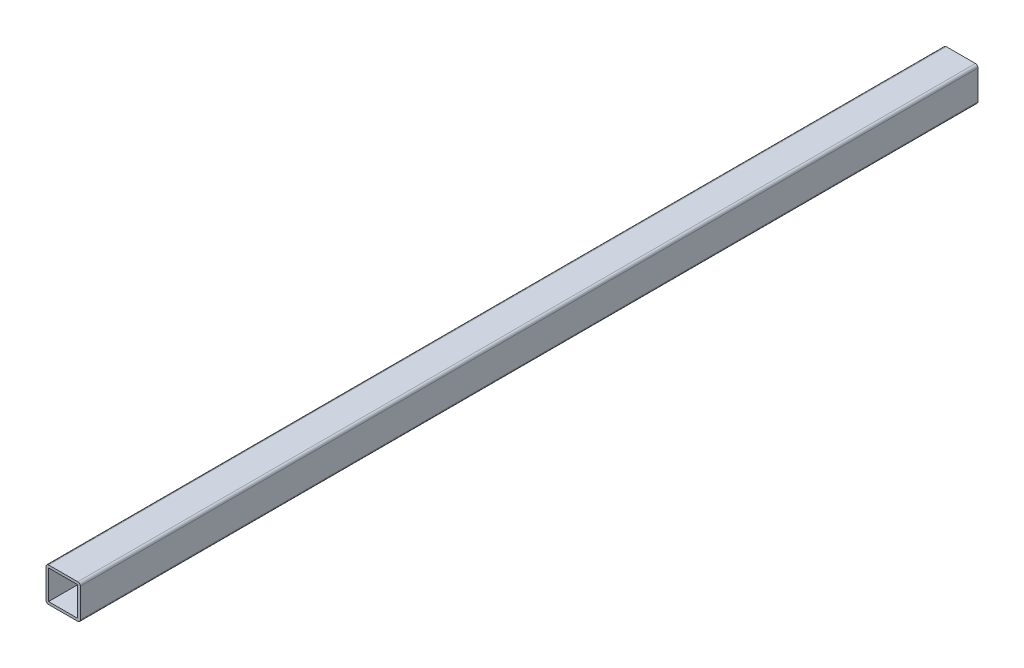
from build123d import *

# Parameters (mm, degrees)
SKETCH1_W           = 40
SKETCH1_H           = 40
BOSS_EXTRUDE1_DEPTH = 1047
FILLET1_R           = 3
SHELL1_START        = -607
SHELL1_OUTLINE_W    = 34
SHELL1_OUTLINE_H    = 1047
SHELL1_DEPTH        = 34


# Read off the part's stored shape, not the designer's step: Shell1
with BuildPart() as part:
    # Sketch1 → Boss-Extrude1 (new body)
    with BuildSketch(Plane.XY):
        with Locations((-590, 590)):
            Rectangle(SKETCH1_W, SKETCH1_H)
    extrude(amount=BOSS_EXTRUDE1_DEPTH)

    # Fillet1
    fillet1_edges = [part.edges().sort_by_distance(p)[0] for p in [
        (-610, 570, 523.5),
        (-570, 570, 523.5),
        (-570, 610, 523.5),
        (-610, 610, 523.5),
    ]]
    fillet(fillet1_edges, radius=FILLET1_R)

    # Shell1 outline → Shell1 (cut)
    with BuildSketch(Plane.YZ.offset(SHELL1_START)):
        with Locations((590, 523.5)):
            Rectangle(SHELL1_OUTLINE_W, SHELL1_OUTLINE_H)
    extrude(amount=SHELL1_DEPTH, mode=Mode.SUBTRACT)


solid = part.part
